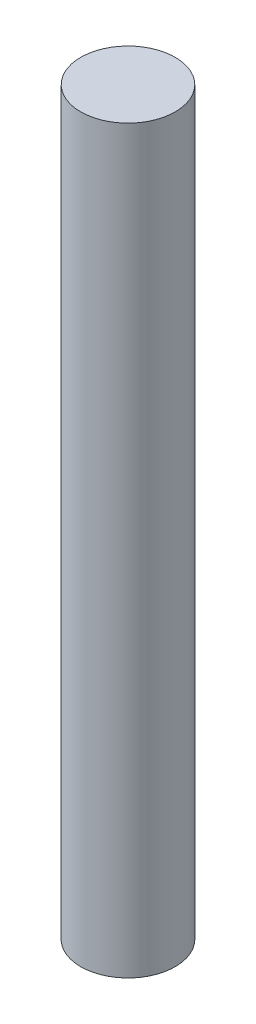
from build123d import *

# Parameters (mm, degrees)
SKETCH1_R           = 3
BOSS_EXTRUDE1_DEPTH = 47


with BuildPart() as part:
    # Sketch1 → Boss-Extrude1 (new body)
    with BuildSketch(Plane(origin=(0, 0, 0), x_dir=(1, 0, 0), z_dir=(0, 1, 0))):
        Circle(SKETCH1_R)
    extrude(amount=BOSS_EXTRUDE1_DEPTH)


solid = part.part
